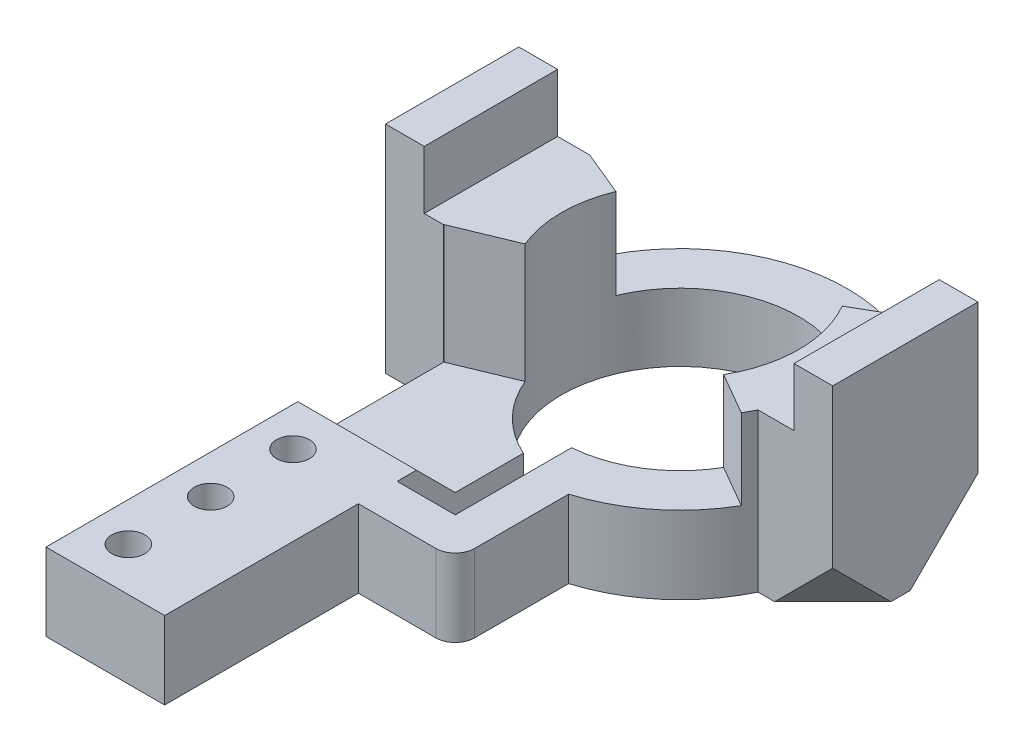
from build123d import *
from build123d.topology import SkipClean

# Parameters (mm, degrees)
SKETCH1_R                = 17.25
SKETCH1_R_2              = 12.25
BOSS_EXTRUDE1_DEPTH      = 4
SKETCH2_W                = 6
SKETCH2_H                = 6.066865377
CUT_EXTRUDE1_DEPTH       = 25.720942539
BOSS_EXTRUDE2_START      = -4
BOSS_EXTRUDE2_DEPTH      = 4
BOSS_EXTRUDE3_DEPTH      = 12.3
BOSS_EXTRUDE4_DEPTH      = 4
BOSS_EXTRUDE4_DEPTH_BACK = 4
SKETCH5_W                = 12.25
SKETCH5_H                = 26
CUT_EXTRUDE2_DEPTH       = 53.669881205
CUT_EXTRUDE2_DEPTH_BACK  = 53.669881205
SKETCH6_R                = 1.7
SKETCH7_R                = 3.05
CUT_EXTRUDE6_DEPTH       = 4
CHAMFER1_SIZE            = 4
BOSS_EXTRUDE5_REACH      = 55.745
BOSS_EXTRUDE6_DEPTH      = 6
BOSS_EXTRUDE6_DEPTH_BACK = 16.3
SKETCH9_W                = 4
SKETCH9_H                = 13.772279307
BOSS_EXTRUDE7_DEPTH      = 4
BOSS_EXTRUDE8_DEPTH      = 16.3
SKETCH12_W               = 4
SKETCH12_H               = 15
BOSS_EXTRUDE9_DEPTH      = 22.3
CHAMFER2_START           = 13.712068893
CHAMFER2_OUTLINE_W       = 11
CHAMFER2_OUTLINE_H       = 13
CHAMFER2_DEPTH           = 5.287931107
CHAMFER3_START           = 14.289419162
CHAMFER3_OUTLINE_W       = 10
CHAMFER3_OUTLINE_H       = 11
CHAMFER3_DEPTH           = 10.664231106
BOSS_EXTRUDE10_DEPTH     = 3
BOSS_EXTRUDE11_DEPTH     = 4


with BuildPart() as part:
    # Sketch1 → Boss-Extrude1 (new body)
    with BuildSketch(Plane(origin=(0, 0, 0), x_dir=(1, 0, 0), z_dir=(0, 1, 0))):
        with Locations(Location((0, 0, 0), (0, 0, 270))):
            Circle(SKETCH1_R)
        with Locations(Location((0, 0, 0), (0, 0, 270))):
            Circle(SKETCH1_R_2, mode=Mode.SUBTRACT)
    extrude(amount=BOSS_EXTRUDE1_DEPTH)

    # Sketch2 → Cut-Extrude1 (cut, through all)
    with BuildSketch(Plane(origin=(0, 4, 0), x_dir=(1, 0, 0), z_dir=(0, 1, 0))):
        with Locations((-2, -14.216567312)):
            Rectangle(SKETCH2_W, SKETCH2_H)
    extrude(amount=-CUT_EXTRUDE1_DEPTH, mode=Mode.SUBTRACT)

    # Sketch3 → Boss-Extrude2 (add)
    with BuildSketch(Plane(origin=(0, 4, 0), x_dir=(1, 0, 0), z_dir=(0, 1, 0)).offset(BOSS_EXTRUDE2_START)):
        with BuildLine():
            Line((-5, -16.509466981), (-5, -22.220990099))
            Line((-5, -22.220990099), (-17.25, -22.220990099))
            Line((-17.25, -22.220990099), (-17.25, 0))
            ThreePointArc((-17.25, 0), (-13.853023136, -10.278922609), (-5, -16.509466981))
        make_face()
    extrude(amount=BOSS_EXTRUDE2_DEPTH)

    # Sketch4 → Boss-Extrude3 (add)
    with SkipClean():  # the faces are left unmerged after this step: merging them gives an invalid solid
        with BuildSketch(Plane(origin=(0, 4, 0), x_dir=(1, 0, 0), z_dir=(0, 1, 0))):
            with BuildLine():
                Line((-17.25, 0), (-17.25, -7.145183951))
                Line((-17.25, -7.145183951), (-11.317524273, -4.687872046))
                ThreePointArc((-11.317524273, -4.687872046), (-12.25, 0), (-11.317524273, 4.687872046))
                Line((-11.317524273, 4.687872046), (-15.936921936, 6.601289208))
                ThreePointArc((-15.936921936, 6.601289208), (-16.918546087, 3.365308055), (-17.25, 0))
            make_face()
            with BuildLine():
                Line((10.608811196, 6.125), (14.938938215, 8.625))
                ThreePointArc((14.938938215, 8.625), (17.25, 0), (14.938938215, -8.625))
                Line((14.938938215, -8.625), (10.608811196, -6.125))
                ThreePointArc((10.608811196, -6.125), (12.25, 0), (10.608811196, 6.125))
            make_face()
        extrude(amount=BOSS_EXTRUDE3_DEPTH)

    # Sketch5 → Boss-Extrude4 (add, two sides: drawn at the far end of the back side and taken through both)
    with SkipClean():  # the faces are left unmerged after this step: merging them gives an invalid solid
        with BuildSketch(Plane(origin=(0, 4, 0), x_dir=(1, 0, 0), z_dir=(0, 1, 0)).offset(-BOSS_EXTRUDE4_DEPTH_BACK)):
            with Locations((-11.125, -35.220990099)):
                Rectangle(SKETCH5_W, SKETCH5_H)
        extrude(amount=BOSS_EXTRUDE4_DEPTH + BOSS_EXTRUDE4_DEPTH_BACK)

    # Sketch6 → Cut-Extrude2 (cut, two sides: drawn at the far end of the back side and taken through both)
    with SkipClean():  # the faces are left unmerged after this step: merging them gives an invalid solid
        with BuildSketch(Plane(origin=(0, 4, 0), x_dir=(1, 0, 0), z_dir=(0, 1, 0)).offset(-CUT_EXTRUDE2_DEPTH_BACK)):
            with Locations(Location((-13.25, -43.720990099, 0), (0, 0, 270))):
                Circle(SKETCH6_R)
            with Locations(Location((-13.25, -35.220990099, 0), (0, 0, 270))):
                Circle(SKETCH6_R)
            with Locations(Location((-13.25, -26.720990099, 0), (0, 0, 270))):
                Circle(SKETCH6_R)
        extrude(amount=CUT_EXTRUDE2_DEPTH + CUT_EXTRUDE2_DEPTH_BACK, mode=Mode.SUBTRACT)

    # Sketch7 → Cut-Extrude6 (cut)
    with SkipClean():  # the faces are left unmerged after this step: merging them gives an invalid solid
        with BuildSketch(Plane.XZ):
            with Locations(Location((-13.25, 43.720990099, 0), (0, 0, 270))):
                Circle(SKETCH7_R)
            with Locations(Location((-13.25, 35.220990099, 0), (0, 0, 270))):
                Circle(SKETCH7_R)
            with Locations(Location((-13.25, 26.720990099, 0), (0, 0, 270))):
                Circle(SKETCH7_R)
        extrude(amount=-CUT_EXTRUDE6_DEPTH, mode=Mode.SUBTRACT)

    # Chamfer1
    chamfer1_edges = [part.edges().sort_by_distance(p)[0] for p in [
        (-11.125, 4, 22.220990099),
    ]]
    chamfer(chamfer1_edges, length=CHAMFER1_SIZE - 0.0001)  # a hair under: the kernel refuses the full size

    # Boss-Extrude5: up to this face of the body (flat: up to its plane)
    boss_extrude5_end = Plane(part.part.faces().sort_by_distance((-14.634101331, 16.3, 0.270569761))[0])
    # Sketch8 → Boss-Extrude5 (add, up to the picked face)
    with BuildSketch(Plane.XZ, mode=Mode.PRIVATE) as boss_extrude5_sk1:
        with BuildLine():
            Line((-17.25, 0), (-17.25, 7.170990099))
            Line((-17.25, 7.170990099), (-19.25, 7.170990099))
            Line((-19.25, 7.170990099), (-19.25, -6.601289208))
            Line((-19.25, -6.601289208), (-15.936921936, -6.601289208))
            ThreePointArc((-15.936921936, -6.601289208), (-16.918546087, -3.365308055), (-17.25, 0))
        make_face()
    boss_extrude5_tool1 = split(extrude(boss_extrude5_sk1.sketch, amount=-BOSS_EXTRUDE5_REACH, mode=Mode.PRIVATE), bisect_by=boss_extrude5_end, keep=Keep.BOTH, mode=Mode.PRIVATE)
    add(boss_extrude5_tool1.solids().sort_by(Axis((-18.119805, 0, -0.206337), (0, 1, 0)))[0])

    # Sketch9 → Boss-Extrude6 (add, two sides: drawn at the far end of the back side and taken through both)
    with BuildSketch(Plane(origin=(0, 16.3, 0), x_dir=(1, 0, 0), z_dir=(0, 1, 0)).offset(-BOSS_EXTRUDE6_DEPTH_BACK)):
        with Locations((-21.25, -0.284850446)):
            Rectangle(SKETCH9_W, SKETCH9_H)
    extrude(amount=BOSS_EXTRUDE6_DEPTH + BOSS_EXTRUDE6_DEPTH_BACK)

    # Sketch10 → Boss-Extrude7 (add)
    with BuildSketch(Plane.XZ):
        with BuildLine():
            Line((-5, 24.220990099), (1, 24.220990099))
            Line((1, 24.220990099), (1, 17.220990099))
            ThreePointArc((1, 17.220990099), (3.021020736, 16.983401712), (5, 16.509466981))
            Line((5, 16.509466981), (5, 26.220990099))
            ThreePointArc((5, 26.220990099), (4.414213562, 27.635203662), (3, 28.220990099))
            Line((3, 28.220990099), (-5, 28.220990099))
            Line((-5, 28.220990099), (-5, 24.220990099))
        make_face()
    extrude(amount=-BOSS_EXTRUDE7_DEPTH)

    # Sketch11 → Boss-Extrude8 (add)
    with BuildSketch(Plane.XZ):
        with BuildLine():
            Line((15.534236383, 7.5), (19.25, 7.5))
            Line((19.25, 7.5), (19.25, -7.5))
            Line((19.25, -7.5), (15.534236383, -7.5))
            ThreePointArc((15.534236383, -7.5), (17.25, 0), (15.534236383, 7.5))
        make_face()
    extrude(amount=-BOSS_EXTRUDE8_DEPTH)

    # Sketch12 → Boss-Extrude9 (add)
    with BuildSketch(Plane.XZ):
        with Locations((21.25, 0)):
            Rectangle(SKETCH12_W, SKETCH12_H)
    extrude(amount=-BOSS_EXTRUDE9_DEPTH)

    # Chamfer2: read off the stored shape, not the designer's step
    # Chamfer2 outline → Chamfer2 (cut)
    with BuildSketch(Plane(origin=(0, 0, 0), x_dir=(0.8164965809277258, 0.40824829046386313, 0.40824829046386313), z_dir=(0.5773502691896258, -0.5773502691896258, -0.5773502691896258)).offset(CHAMFER2_START)):
        with Locations((14.5, -5.5)):
            Rectangle(CHAMFER2_OUTLINE_W, CHAMFER2_OUTLINE_H)
    extrude(amount=CHAMFER2_DEPTH, mode=Mode.SUBTRACT)

    # Chamfer3: read off the stored shape, not the designer's step
    # Chamfer3 outline → Chamfer3 (cut)
    with BuildSketch(Plane(origin=(0, 0, 0), x_dir=(0.8164965809277258, 0.40824829046386313, -0.40824829046386313), z_dir=(0.5773502691896258, -0.5773502691896258, 0.5773502691896258)).offset(CHAMFER3_START)):
        with Locations((15, 5.5)):
            Rectangle(CHAMFER3_OUTLINE_W, CHAMFER3_OUTLINE_H)
    extrude(amount=CHAMFER3_DEPTH, mode=Mode.SUBTRACT)

    # Sketch13 → Boss-Extrude10 (add)
    with BuildSketch(Plane(origin=(0, 4, 0), x_dir=(1, 0, 0), z_dir=(0, 1, 0))):
        with BuildLine():
            Line((-15.936921936, 6.601289208), (-11.317524273, 4.687872046))
            ThreePointArc((-11.317524273, 4.687872046), (-0.801188333, 12.22377181), (10.608811196, 6.125))
            Line((10.608811196, 6.125), (14.938938215, 8.625))
            ThreePointArc((14.938938215, 8.625), (-1.128203979, 17.213066426), (-15.936921936, 6.601289208))
        make_face()
    extrude(amount=BOSS_EXTRUDE10_DEPTH)

    # Sketch14 → Boss-Extrude11 (add)
    with BuildSketch(Plane(origin=(0, 4, 0), x_dir=(1, 0, 0), z_dir=(0, 1, 0))):
        with BuildLine():
            Line((14.938938215, -8.625), (10.608811196, -6.125))
            ThreePointArc((10.608811196, -6.125), (6.553261748, -10.349746879), (1, -12.209115447))
            Line((1, -12.209115447), (1, -24.220990099))
            Line((1, -24.220990099), (-5, -24.220990099))
            Line((-5, -24.220990099), (-5, -28.220990099))
            Line((-5, -28.220990099), (3, -28.220990099))
            ThreePointArc((3, -28.220990099), (4.414213562, -27.635203662), (5, -26.220990099))
            Line((5, -26.220990099), (5, -16.509466981))
            ThreePointArc((5, -16.509466981), (10.720611885, -13.514103034), (14.938938215, -8.625))
        make_face()
    extrude(amount=BOSS_EXTRUDE11_DEPTH)


solid = part.part
